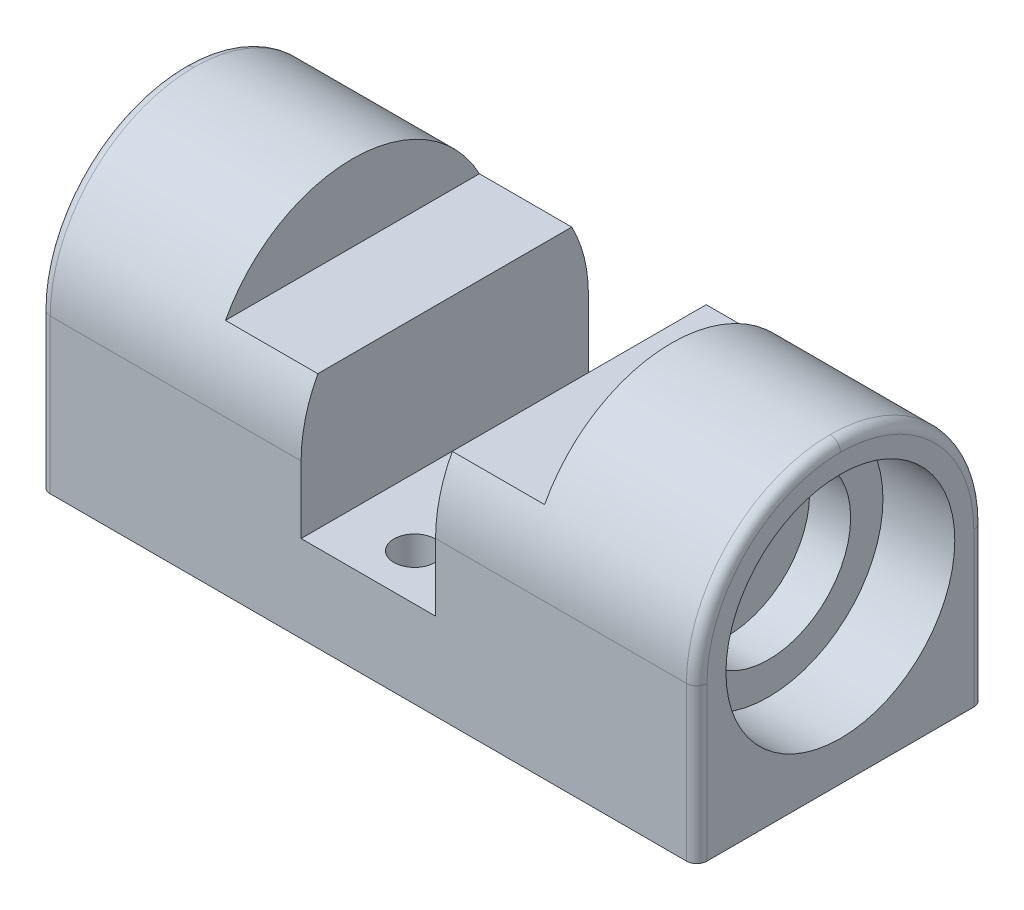
from build123d import *

# Parameters (mm, degrees)
SKETCH1_R                       = 26
SKETCH1_R_2                     = 21.249999999999996
BOSS_EXTRUDE1_DEPTH             = 9
BOSS_EXTRUDE2_START             = 2
SKETCH2_R                       = 26.000000000000007
SKETCH2_R_2                     = 21.249999999999996
BOSS_EXTRUDE2_DEPTH             = 2
BOSS_EXTRUDE3_REACH             = 40.38
BOSS_EXTRUDE3_DIRECTION_2_DEPTH = 18
SKETCH4_R                       = 11.15
CUT_EXTRUDE1_DEPTH              = 7
CUT_EXTRUDE2_START              = -7
SKETCH5_R                       = 11.15
CUT_EXTRUDE2_DEPTH              = 7
FILLET2_R                       = 14
FILLET4_R                       = 1
SKETCH8_W                       = 43.8178046004133
SKETCH8_H                       = 27.999999999999993
BOSS_EXTRUDE4_DEPTH             = 11
SKETCH9_W                       = 43.8178046004133
SKETCH9_H                       = 11.999999999999998
CUT_EXTRUDE4_DEPTH              = 45.988887516807985
BOSS_EXTRUDE5_DEPTH             = 42.5
SKETCH6_R                       = 8
CUT_EXTRUDE3_DEPTH              = 65.6065012208524
BOSS_EXTRUDE6_START             = -4
BOSS_EXTRUDE6_DEPTH             = 42
SKETCH11_R                      = 2
CUT_EXTRUDE5_DEPTH              = 46.39823785126468
CUT_EXTRUDE6_DEPTH              = 51.36864114704705


with BuildPart() as part:
    # Sketch1 → Boss-Extrude1 (new body)
    with BuildSketch(Plane(origin=(0, 0, 0), x_dir=(1, 0, 0), z_dir=(0, 1, 0))):
        with Locations(Location((0, 0, 0), (0, 0, 270))):
            Circle(SKETCH1_R)
        with Locations(Location((0, 0, 0), (0, 0, 270))):
            Circle(SKETCH1_R_2, mode=Mode.SUBTRACT)
    extrude(amount=BOSS_EXTRUDE1_DEPTH)

    # Sketch2 → Boss-Extrude2 (add)
    with BuildSketch(Plane.XZ.offset(BOSS_EXTRUDE2_START)):
        with Locations(Location((0, 0, 0), (0, 0, 270))):
            Circle(SKETCH2_R)
        with Locations(Location((0, 0, 0), (0, 0, 270))):
            Circle(SKETCH2_R_2, mode=Mode.SUBTRACT)
    extrude(amount=-BOSS_EXTRUDE2_DEPTH)

    # Boss-Extrude3: up to this face of the body (flat: up to its plane)
    boss_extrude3_end = Plane(part.part.faces().sort_by_distance((0, -2, 25.264608948))[0])
    # Sketch3 → Boss-Extrude3 (add, up to the picked face)
    with BuildSketch(Plane(origin=(0, 9, 0), x_dir=(1, 0, 0), z_dir=(0, 1, 0)), mode=Mode.PRIVATE) as boss_extrude3_sk1:
        Polygon((21.249999999999996, 14.000000000000002), (32, 14.000000000000002), (32.00000000000001, -13.999999999999998), (21.250000000000004, -13.999999999999998), align=None)
    boss_extrude3_tool1 = split(extrude(boss_extrude3_sk1.sketch, amount=-BOSS_EXTRUDE3_REACH, mode=Mode.PRIVATE), bisect_by=boss_extrude3_end, keep=Keep.BOTH, mode=Mode.PRIVATE)
    # Sketch3 → Boss-Extrude3 (add, up to the picked face)
    with BuildSketch(Plane(origin=(0, 9, 0), x_dir=(1, 0, 0), z_dir=(0, 1, 0)), mode=Mode.PRIVATE) as boss_extrude3_sk2:
        Polygon((-32, 13.999999999999995), (-21.25, 13.999999999999995), (-21.250000000000004, -14.000000000000005), (-32, -14.000000000000004), align=None)
    boss_extrude3_tool2 = split(extrude(boss_extrude3_sk2.sketch, amount=-BOSS_EXTRUDE3_REACH, mode=Mode.PRIVATE), bisect_by=boss_extrude3_end, keep=Keep.BOTH, mode=Mode.PRIVATE)
    add(boss_extrude3_tool1.solids().sort_by(Axis((26.625, 9, 0), (0, -1, 0)))[0])
    add(boss_extrude3_tool2.solids().sort_by(Axis((-26.625, 9, 0), (0, -1, 0)))[0])

    # Sketch3 → Boss-Extrude3 direction 2 (add)
    with BuildSketch(Plane(origin=(0, 9, 0), x_dir=(1, 0, 0), z_dir=(0, 1, 0))):
        Polygon((21.249999999999996, 14.000000000000002), (32, 14.000000000000002), (32.00000000000001, -13.999999999999998), (21.250000000000004, -13.999999999999998), align=None)
        Polygon((-32, 13.999999999999995), (-21.25, 13.999999999999995), (-21.250000000000004, -14.000000000000005), (-32, -14.000000000000004), align=None)
    extrude(amount=BOSS_EXTRUDE3_DIRECTION_2_DEPTH)

    # Sketch4 → Cut-Extrude1 (cut)
    with BuildSketch(Plane(origin=(32.00000000000001, 0, -7.93e-15), x_dir=(-2.8e-16, 0, -1), z_dir=(1, 0, -2.8e-16))):
        with Locations((0, 12.999999999999998)):
            Circle(SKETCH4_R)
    extrude(amount=-CUT_EXTRUDE1_DEPTH, mode=Mode.SUBTRACT)

    # Sketch5 → Cut-Extrude2 (cut)
    with BuildSketch(Plane.ZY.offset(32).offset(CUT_EXTRUDE2_START)):
        with Locations(Location((-7.93e-15, 12.999999999999998, 0), (0, 0, 180))):
            Circle(SKETCH5_R)
    extrude(amount=CUT_EXTRUDE2_DEPTH, mode=Mode.SUBTRACT)

    # Fillet2
    fillet2_edges = [part.edges().sort_by_distance(p)[0] for p in [
        (-26.625, 27, 14.000000000000004),
        (-26.625, 27, -13.999999999999995),
        (26.625, 27, -14.000000000000002),
        (26.625000000000007, 27, 13.999999999999998),
    ]]
    fillet(fillet2_edges, radius=FILLET2_R - 0.0001)  # a hair under: the kernel refuses the full size

    # Fillet4
    fillet4_edges = [part.edges().sort_by_distance(p)[0] for p in [
        (-32, 3.5, 14.000000000000004),
        (-32, 3.5, -13.999999999999995),
        (-32, 22.89952422593355, -9.899524225933543),
        (-32, 22.899524225933547, 9.899524225933554),
        (32, 5.500050000000002, -14.000000000000004),
        (32.00000000000001, 5.500050000000002, 14),
        (32, 22.899524225933547, 9.89952422593355),
        (32, 22.89952422593355, -9.89952422593355),
    ]]
    fillet(fillet4_edges, radius=FILLET4_R)

    # Sketch8 → Boss-Extrude4 (add)
    with BuildSketch(Plane.XZ.offset(2)):
        Rectangle(SKETCH8_W, SKETCH8_H)
    extrude(amount=-BOSS_EXTRUDE4_DEPTH)

    # Sketch9 → Cut-Extrude4 (cut, through all)
    with BuildSketch(Plane(origin=(0, 9, 0), x_dir=(1, 0, 0), z_dir=(0, 1, 0))):
        Polygon((21.90890230020665, 14.000000000000002), (-21.908902300206655, 14.000000000000002), (-21.908902300206652, 25.999999999999996), (21.908902300206652, 25.999999999999996), align=None)
        with Locations((0, -20.000000000000004)):
            Rectangle(SKETCH9_W, SKETCH9_H)
    extrude(amount=-CUT_EXTRUDE4_DEPTH, mode=Mode.SUBTRACT)

    # Sketch12 → Boss-Extrude5 (add)
    with BuildSketch(Plane.ZY.offset(-21.25)):
        with BuildLine():
            Line((-13.999999999999996, 12.999999999999998), (-13.999999999999996, 9.000000000000002))
            Line((-13.999999999999996, 9.000000000000002), (14.00000000000001, 9))
            Line((14.00000000000001, 9), (14.000000000000004, 12.999999999999996))
            ThreePointArc((14.000000000000004, 12.999999999999996), (9.89949493661167, 22.89949493661166), (6.12e-15, 26.999999999999996))
            ThreePointArc((6.12e-15, 26.999999999999996), (-9.899494936611658, 22.89949493661166), (-13.999999999999996, 12.999999999999998))
        make_face()
    extrude(amount=BOSS_EXTRUDE5_DEPTH)

    # Sketch6 → Cut-Extrude3 (cut, through all)
    with BuildSketch(Plane(origin=(25.000000000000007, 0, -6.94e-15), x_dir=(-2.8e-16, 0, -1), z_dir=(1, 0, -2.8e-16))):
        with Locations((0, 12.999999999999998)):
            Circle(SKETCH6_R)
    extrude(amount=-CUT_EXTRUDE3_DEPTH, mode=Mode.SUBTRACT)

    # Sketch14 → Boss-Extrude6 (add)
    with BuildSketch(Plane(origin=(25.000000000000007, 0, -6.94e-15), x_dir=(-2.8e-16, 0, -1), z_dir=(1, 0, -2.8e-16)).offset(BOSS_EXTRUDE6_START)):
        with BuildLine():
            Line((-14.000000000000007, -2.0000000000000018), (-14.000000000000007, 12.999999999999996))
            ThreePointArc((-14.000000000000007, 12.999999999999996), (-9.899494936611672, 22.89949493661166), (-8.6e-15, 26.999999999999996))
            ThreePointArc((-8.6e-15, 26.999999999999996), (9.899494936611658, 22.89949493661166), (13.999999999999993, 12.999999999999996))
            Line((13.999999999999993, 12.999999999999996), (13.999999999999993, -2.0000000000000018))
            Line((13.999999999999993, -2.0000000000000018), (-14.000000000000007, -2.0000000000000018))
        make_face()
    extrude(amount=-BOSS_EXTRUDE6_DEPTH)

    # Sketch11 → Cut-Extrude5 (cut, through all)
    with BuildSketch(Plane.XZ.offset(2)):
        with Locations(Location((0, -9.5, 0), (0, 0, 270))):
            Circle(SKETCH11_R)
        with Locations(Location((0, 9.5, 0), (0, 0, 270))):
            Circle(SKETCH11_R)
        with Locations(Location((1.73e-15, -3.47e-15, 0), (0, 0, 270))):
            Circle(SKETCH11_R)
    extrude(amount=-CUT_EXTRUDE5_DEPTH, mode=Mode.SUBTRACT)

    # Sketch13 → Cut-Extrude6 (cut, through all)
    with BuildSketch(Plane(origin=(0, 0, -13.999999999999995), x_dir=(-1, 0, 0), z_dir=(0, 0, -1))):
        Polygon((15.547241809262866, 33.06287004539835), (15.54724180926287, 19.549999999999997), (0, 19.549999999999997), (-15.54724180926287, 19.549999999999994), (-15.54724180926287, 33.06287004539835), align=None)
        Polygon((6.549999999999999, 19.549999999999997), (0, 19.549999999999997), (-6.550000000000001, 19.549999999999997), (-6.55, 12.999999999999996), (6.550000000000001, 12.999999999999996), align=None)
        Polygon((6.550000000000001, 6.4499999999999975), (6.55, 12.999999999999996), (-6.549999999999997, 12.999999999999996), (-6.549999999999999, 6.4499999999999975), align=None)
    extrude(amount=-CUT_EXTRUDE6_DEPTH, mode=Mode.SUBTRACT)


solid = part.part
